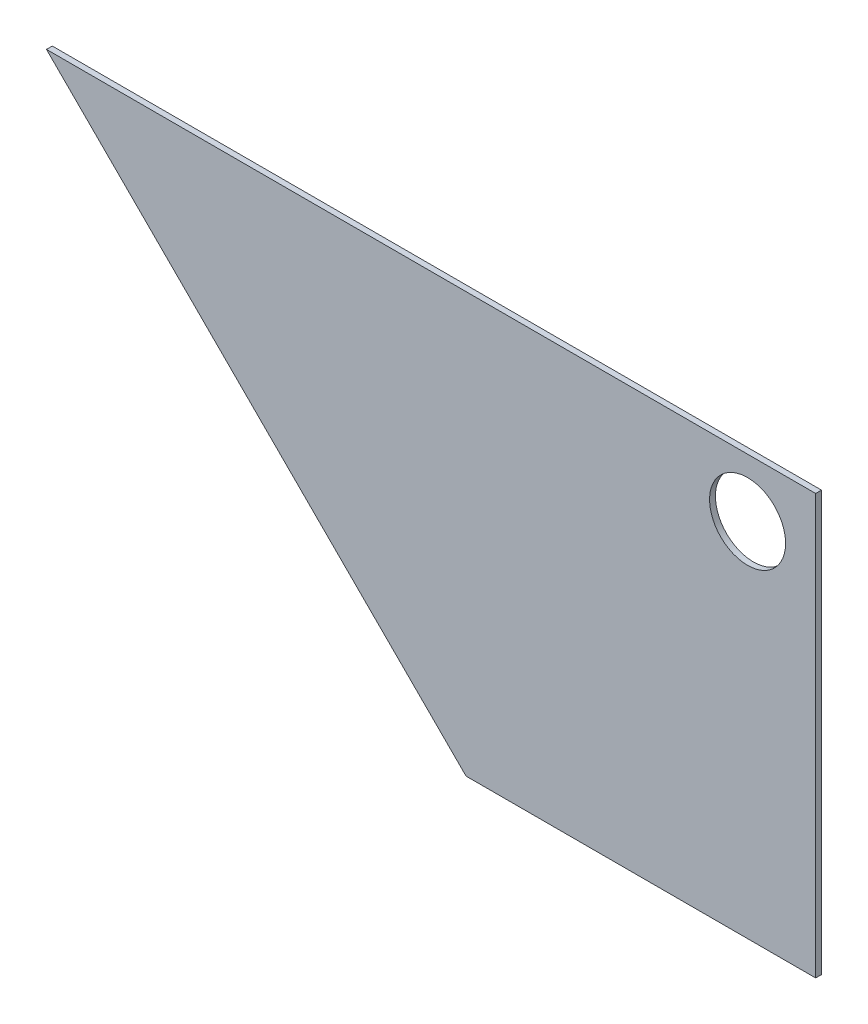
from build123d import *

# Parameters (mm, degrees)
BOSS_EXTRUDE1_DEPTH = 3.175
SKETCH3_R           = 20.701
CUT_EXTRUDE2_DEPTH  = 254.706791824


with BuildPart() as part:
    # Sketch1 → Boss-Extrude1 (new body)
    with BuildSketch(Plane.XY):
        Polygon((-196.389372196, 107.121475743), (32.210627804, -121.478524257), (222.710627804, -121.478524257), (222.710627804, 107.121475743), align=None)
    extrude(amount=BOSS_EXTRUDE1_DEPTH)

    # Sketch3 → Cut-Extrude2 (cut, through all)
    with BuildSketch(Plane.XY.offset(3.175)):
        with Locations((185.590616526, 75.371475743)):
            Circle(SKETCH3_R)
    extrude(amount=-CUT_EXTRUDE2_DEPTH, mode=Mode.SUBTRACT)


solid = part.part
